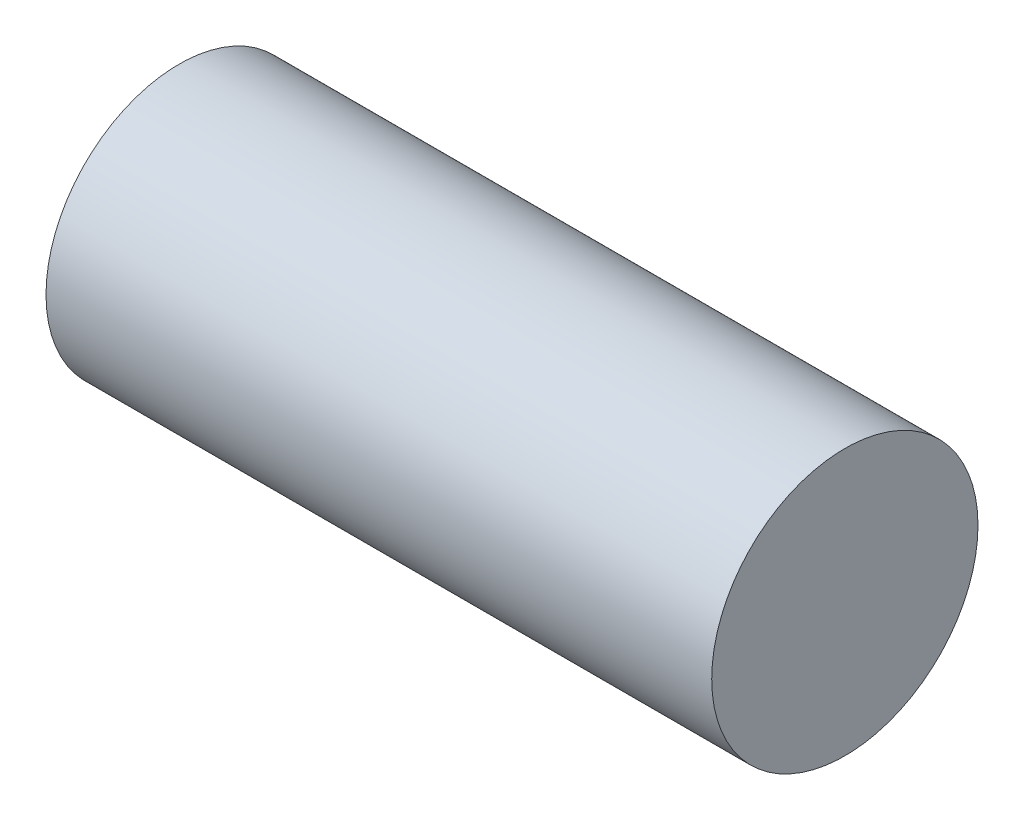
from build123d import *

# Parameters (mm, degrees)
SKETCH9_R           = 2
BOSS_EXTRUDE1_DEPTH = 10


with BuildPart() as part:
    # Sketch9 → Boss-Extrude1 (new body)
    with BuildSketch(Plane(origin=(0, 0, 0), x_dir=(0, 0, -1), z_dir=(1, 0, 0))):
        Circle(SKETCH9_R)
    extrude(amount=BOSS_EXTRUDE1_DEPTH)


solid = part.part
